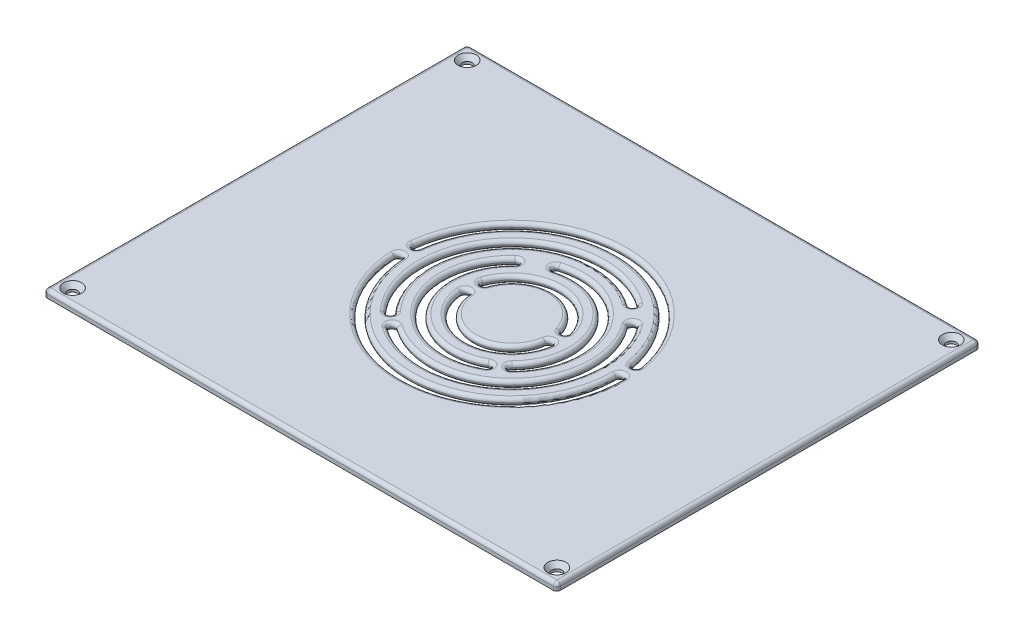
from build123d import *

# Parameters (mm, degrees)
BOSS_EXTRUDE1_DEPTH                           = 2
CSK_FOR_3_FLAT_HEAD_MACHINE_SCREW1_AT_2_COUNT = 2
CSK_FOR_3_FLAT_HEAD_MACHINE_SCREW1_AT_2_PITCH = 134.99999999999997
CSK_FOR_3_FLAT_HEAD_MACHINE_SCREW1_AT_3_COUNT = 2
CSK_FOR_3_FLAT_HEAD_MACHINE_SCREW1_AT_3_PITCH = 174.14074767267996
CSK_FOR_3_FLAT_HEAD_MACHINE_SCREW1_AT_4_COUNT = 2
CSK_FOR_3_FLAT_HEAD_MACHINE_SCREW1_AT_4_PITCH = 109.99999999999999
SKETCH8_R                                     = 0.00040494750000225
SKETCH8_R_2                                   = 0.00013498249999858
SKETCH8_R_3                                   = 0.00013498250000184
CUT_EXTRUDE1_DEPTH                            = 2
FILLET2_R                                     = 1
FILLET3_R                                     = 1
FILLET4_R                                     = 1
FILLET5_R                                     = 1
FILLET6_R                                     = 1
FILLET7_R                                     = 1
FILLET8_R                                     = 1
FILLET9_R                                     = 1
FILLET10_R                                    = 1
FILLET11_R                                    = 1
FILLET12_R                                    = 1
FILLET13_R                                    = 1
FILLET14_R                                    = 1
FILLET15_R                                    = 1
FILLET16_R                                    = 1
FILLET17_R                                    = 1


with BuildPart() as part:
    # Sketch1 → Boss-Extrude1 (new body)
    with BuildSketch(Plane(origin=(0, 0, 0), x_dir=(1, 0, 0), z_dir=(0, 1, 0))):
        Polygon((-71.49999999999997, 59), (71.50000000000001, 59), (71.50000000000004, -59), (-71.49999999999996, -59), align=None)
    extrude(amount=BOSS_EXTRUDE1_DEPTH)

    # Sketch7 → CSK for #3 Flat Head Machine Screw1 (revolve, cut)
    with BuildSketch(Plane(origin=(67.50000000000003, 2, 54.99999999999999), x_dir=(0, 0, 1), z_dir=(1, 0, 0))):
        Polygon((0, 0), (-4.9e-16, 1.9999999999999996), (1.3969999999999994, 1.9999999999999996), (1.3969999999999996, 1.3002614106819081), (2.5273, -1.73e-15), align=None)
    csk_for_3_flat_head_machine_screw1 = revolve(axis=Axis((67.50000000000003, 8.34999999999999, 54.99999999999999), (0, -1, 0)), mode=Mode.SUBTRACT)

    # CSK for #3 Flat Head Machine Screw1 at 2: CSK for #3 Flat Head Machine Screw1 ×2
    with Locations(*[(-i * CSK_FOR_3_FLAT_HEAD_MACHINE_SCREW1_AT_2_PITCH, 0, 0) for i in range(1, CSK_FOR_3_FLAT_HEAD_MACHINE_SCREW1_AT_2_COUNT)]):
        add(csk_for_3_flat_head_machine_screw1, mode=Mode.SUBTRACT)

    # CSK for #3 Flat Head Machine Screw1 at 3: CSK for #3 Flat Head Machine Screw1 ×2
    with Locations(*[Vector(-0.7752349855172892, 0, -0.6316729511622358) * (i * CSK_FOR_3_FLAT_HEAD_MACHINE_SCREW1_AT_3_PITCH) for i in range(1, CSK_FOR_3_FLAT_HEAD_MACHINE_SCREW1_AT_3_COUNT)]):
        add(csk_for_3_flat_head_machine_screw1, mode=Mode.SUBTRACT)

    # CSK for #3 Flat Head Machine Screw1 at 4: CSK for #3 Flat Head Machine Screw1 ×2
    with Locations(*[(0, 0, -i * CSK_FOR_3_FLAT_HEAD_MACHINE_SCREW1_AT_4_PITCH) for i in range(1, CSK_FOR_3_FLAT_HEAD_MACHINE_SCREW1_AT_4_COUNT)]):
        add(csk_for_3_flat_head_machine_screw1, mode=Mode.SUBTRACT)

    # Sketch8 → Cut-Extrude1 (cut)
    # profile 1 of 9: a face of its own
    with BuildSketch(Plane(origin=(0, 2, 0), x_dir=(1, 0, 0), z_dir=(0, 1, 0))):
        Circle(SKETCH8_R)
        Circle(SKETCH8_R_2, mode=Mode.SUBTRACT)
        with Locations((0.00025007018484301, -0.00010171530798169)):
            Circle(SKETCH8_R_3, mode=Mode.SUBTRACT)
        with Locations((-9.735881093734e-05, 0.00025179825884643)):
            Circle(SKETCH8_R_3, mode=Mode.SUBTRACT)
    # profile 2 of 9: a face of its own
    with BuildSketch(Plane(origin=(0, 2, 0), x_dir=(1, 0, 0), z_dir=(0, 1, 0))):
        with BuildLine():
            ThreePointArc((-30.946443151412506, -1.8260323598653043), (0.9134127633680493, -30.986810339668672), (31.000269965, -4.4e-13))
            ThreePointArc((31.000269965, -4.4e-13), (30.00026996500002, 0.9999999999995707), (29.000269964999998, -4.1162e-13))
            ThreePointArc((29.000269964999998, -4.1162e-13), (0.8544834208559154, -28.987678695031157), (-28.949915818821417, -1.7082248464515866))
            ThreePointArc((-28.949915818821417, -1.7082248464515866), (-30.007083241823825, -0.7688649368628956), (-30.946443151412506, -1.8260323598653043))
        make_face()
    # profile 3 of 9: a face of its own
    with BuildSketch(Plane(origin=(0, 2, 0), x_dir=(1, 0, 0), z_dir=(0, 1, 0))):
        with BuildLine():
            ThreePointArc((30.566686260638235, 5.166665166874168), (-0.9217422064956403, 30.986563688276984), (-30.81974870682131, 3.3406328070093023))
            ThreePointArc((-30.81974870682131, 3.3406328070093023), (-29.93333333267017, 2.2386946125226626), (-28.831395138183524, 3.1251099866738055))
            ThreePointArc((-28.831395138183524, 3.1251099866738055), (-0.8622754852357087, 28.987447956493902), (28.59465915925178, 4.83333483312498))
            ThreePointArc((28.59465915925178, 4.83333483312498), (29.747337876819604, 4.013986449306345), (30.566686260638235, 5.166665166874168))
        make_face()
    # profile 4 of 9: a face of its own
    with BuildSketch(Plane(origin=(0, 2, 0), x_dir=(1, 0, 0), z_dir=(0, 1, 0))):
        with BuildLine():
            ThreePointArc((14.890218866781684, 20.08220307690916), (-18.60991899447516, 16.69384357605982), (-18.35268417081552, -16.976232858004106))
            ThreePointArc((-18.35268417081552, -16.976232858004106), (-16.939542749611693, -17.031290315973095), (-16.8844852916427, -15.618148894769266))
            ThreePointArc((-16.8844852916427, -15.618148894769266), (-17.121141551629247, 15.358350511430444), (13.699014220781644, 18.475644179343345))
            ThreePointArc((13.699014220781644, 18.475644179343345), (15.09789599256457, 18.683321305126235), (14.890218866781684, 20.08220307690916))
        make_face()
    # profile 5 of 9: a face of its own
    with BuildSketch(Plane(origin=(0, 2, 0), x_dir=(1, 0, 0), z_dir=(0, 1, 0))):
        with BuildLine():
            ThreePointArc((-14.436978590399093, -20.410466616499455), (17.86500741837908, -17.48871088056924), (20.0985498566952, 14.86814689128468))
            ThreePointArc((20.0985498566952, 14.86814689128468), (18.699897090267772, 15.077360750684315), (18.490683230868143, 13.678707984256892))
            ThreePointArc((18.490683230868143, 13.678707984256892), (16.435822258107635, -16.08962911824803), (-13.282032774965058, -18.777646919346292))
            ThreePointArc((-13.282032774965058, -18.777646919346292), (-14.675915531258662, -19.016583860205856), (-14.436978590399093, -20.410466616499455))
        make_face()
    # profile 6 of 9: a face of its own
    with BuildSketch(Plane(origin=(0, 2, 0), x_dir=(1, 0, 0), z_dir=(0, 1, 0))):
        with BuildLine():
            ThreePointArc((13.407298044144591, -13.463083521183313), (16.370478001502615, 9.644568872956423), (-5.277773611713719, 18.252544054086805))
            ThreePointArc((-5.277773611713719, 18.252544054086805), (-5.960646563849325, 17.014123878523765), (-4.722226388286285, 16.33125092638815))
            ThreePointArc((-4.722226388286285, 16.33125092638815), (14.64729427499154, 8.629365521559576), (11.996023565535404, -12.045936970530784))
            ThreePointArc((11.996023565535404, -12.045936970530784), (11.993087529513732, -13.460147485161643), (13.407298044144591, -13.463083521183313))
        make_face()
    # profile 7 of 9: a face of its own
    with BuildSketch(Plane(origin=(0, 2, 0), x_dir=(1, 0, 0), z_dir=(0, 1, 0))):
        with BuildLine():
            ThreePointArc((-13.033097685767059, 13.825650923415305), (-15.34968359879394, -11.198101274760713), (9.186611442658458, -16.631789709604245))
            ThreePointArc((9.186611442658458, -16.631789709604245), (9.578457362777508, -15.272945798448134), (8.219613451621395, -14.88109987832908))
            ThreePointArc((8.219613451621395, -14.88109987832908), (-13.733950387942805, -10.019370520367382), (-11.661212158900858, 12.370339925320728))
            ThreePointArc((-11.661212158900858, 12.370339925320728), (-11.61949942328667, 13.783938187801112), (-13.033097685767059, 13.825650923415305))
        make_face()
    # profile 8 of 9: a face of its own
    with BuildSketch(Plane(origin=(0, 2, 0), x_dir=(1, 0, 0), z_dir=(0, 1, 0))):
        with BuildLine():
            ThreePointArc((12.507486111078903, 3.545392833530498), (0.2917565528968115, 12.996995701958314), (-12.335793314493415, 4.103074757420425))
            ThreePointArc((-12.335793314493415, 4.103074757420425), (-11.702520422527517, 2.838572703526824), (-10.438018368633914, 3.471845595492722))
            ThreePointArc((-10.438018368633914, 3.471845595492722), (0.2468718614738936, 10.997499424273393), (10.583297437343331, 2.999959108988534))
            ThreePointArc((10.583297437343331, 2.999959108988534), (11.8181086364821, 2.3105816343917303), (12.507486111078903, 3.545392833530498))
        make_face()
    # profile 9 of 9: a face of its own
    with BuildSketch(Plane(origin=(0, 2, 0), x_dir=(1, 0, 0), z_dir=(0, 1, 0))):
        with BuildLine():
            ThreePointArc((-12.933735735852103, -1.3135825356723971), (-0.2809576911659622, -12.99723362637819), (12.864889757990937, -1.8712644595623238))
            ThreePointArc((12.864889757990937, -1.8712644595623238), (12.019243834635018, -0.7377376745627237), (10.885717049635417, -1.5833835979186432))
            ThreePointArc((10.885717049635417, -1.5833835979186432), (-0.23773432858620466, -10.997700745696472), (-10.943971558543012, -1.1114971114144552))
            ThreePointArc((-10.943971558543012, -1.1114971114144552), (-12.039896359326528, -0.21765773488888074), (-12.933735735852103, -1.3135825356723971))
        make_face()
    extrude(amount=-CUT_EXTRUDE1_DEPTH, mode=Mode.SUBTRACT)


with BuildPart() as cut_extrude1_kept_piece:
    # of the separate pieces the step leaves, the one the design keeps (cut_extrude1_pieces_kept)
    add(part.part.solids().sort_by_distance((-71.5, 0, -59))[0])

    # Fillet2
    fillet2_edges = [cut_extrude1_kept_piece.edges().sort_by_distance(p)[0] for p in [
        (-11.619499423286673, 2, -13.783938187801114),
        (-15.34968359879394, 2, 11.198101274760713),
        (9.578457362777508, 2, 15.272945798448132),
        (-13.7339503879428, 2, 10.019370520367383),
    ]]
    fillet(fillet2_edges, radius=FILLET2_R)

    # Fillet3
    fillet3_edges = [cut_extrude1_kept_piece.edges().sort_by_distance(p)[0] for p in [
        (29.7473378768196, 2, -4.013986449306344),
        (-0.9217422064956402, 2, -30.986563688276984),
        (-29.933333332670166, 2, -2.2386946125226617),
        (-0.8622754852357071, 2, -28.98744795649391),
    ]]
    fillet(fillet3_edges, radius=FILLET3_R)

    # Fillet4
    fillet4_edges = [cut_extrude1_kept_piece.edges().sort_by_distance(p)[0] for p in [
        (-0.9217422064956402, 0, -30.986563688276984),
        (29.7473378768196, 0, -4.013986449306344),
        (-0.8622754852357071, 0, -28.98744795649391),
        (-29.933333332670166, 0, -2.2386946125226617),
    ]]
    fillet(fillet4_edges, radius=FILLET4_R - 0.0001)  # a hair under: the kernel refuses the full size

    # Fillet5
    fillet5_edges = [cut_extrude1_kept_piece.edges().sort_by_distance(p)[0] for p in [
        (11.993087529513732, 0, 13.460147485161643),
        (14.647294274991536, 0, -8.629365521559576),
        (-5.960646563849323, 0, -17.014123878523765),
        (16.370478001502615, 0, -9.64456887295642),
    ]]
    fillet(fillet5_edges, radius=FILLET5_R)

    # Fillet6
    fillet6_edges = [cut_extrude1_kept_piece.edges().sort_by_distance(p)[0] for p in [
        (15.09789599256457, 2, -18.683321305126235),
        (-18.609918994475155, 2, -16.69384357605982),
        (-16.93954274961169, 2, 17.03129031597309),
        (-17.121141551629247, 2, -15.358350511430444),
    ]]
    fillet(fillet6_edges, radius=FILLET6_R)

    # Fillet7
    fillet7_edges = [cut_extrude1_kept_piece.edges().sort_by_distance(p)[0] for p in [
        (-17.121141551629247, 0, -15.358350511430444),
        (-16.93954274961169, 0, 17.03129031597309),
        (-18.609918994475155, 0, -16.69384357605982),
        (15.09789599256457, 0, -18.683321305126235),
    ]]
    fillet(fillet7_edges, radius=FILLET7_R - 0.0001)  # a hair under: the kernel refuses the full size

    # Fillet8
    fillet8_edges = [cut_extrude1_kept_piece.edges().sort_by_distance(p)[0] for p in [
        (-12.039896359326528, 0, 0.21765773488888085),
        (-0.2377343285862057, 0, 10.997700745696472),
        (12.019243834635018, 0, 0.7377376745627235),
        (-0.2809576911659626, 0, 12.997233626378192),
    ]]
    fillet(fillet8_edges, radius=FILLET8_R)

    # Fillet9
    fillet9_edges = [cut_extrude1_kept_piece.edges().sort_by_distance(p)[0] for p in [
        (9.578457362777508, 0, 15.272945798448132),
        (-13.7339503879428, 0, 10.019370520367383),
        (-15.34968359879394, 0, 11.198101274760713),
        (-11.619499423286673, 0, -13.783938187801114),
    ]]
    fillet(fillet9_edges, radius=FILLET9_R - 0.0001)  # a hair under: the kernel refuses the full size

    # Fillet10
    fillet10_edges = [cut_extrude1_kept_piece.edges().sort_by_distance(p)[0] for p in [
        (-0.2809576911659626, 2, 12.997233626378192),
        (12.019243834635018, 2, 0.7377376745627235),
        (-0.2377343285862057, 2, 10.997700745696472),
        (-12.039896359326528, 2, 0.21765773488888085),
    ]]
    fillet(fillet10_edges, radius=FILLET10_R - 0.0001)  # a hair under: the kernel refuses the full size

    # Fillet11
    fillet11_edges = [cut_extrude1_kept_piece.edges().sort_by_distance(p)[0] for p in [
        (-30.00708324182382, 0, 0.768864936862895),
        (0.8544834208559159, 0, 28.987678695031157),
        (30.00026996500001, 0, -0.9999999999995712),
        (0.9134127633680436, 0, 30.986810339668672),
    ]]
    fillet(fillet11_edges, radius=FILLET11_R)

    # Fillet12
    fillet12_edges = [cut_extrude1_kept_piece.edges().sort_by_distance(p)[0] for p in [
        (-14.675915531258662, 2, 19.016583860205856),
        (17.865007418379086, 2, 17.488710880569233),
        (18.699897090267775, 2, -15.077360750684319),
        (16.435822258107645, 2, 16.089629118248023),
    ]]
    fillet(fillet12_edges, radius=FILLET12_R)

    # Fillet13
    fillet13_edges = [cut_extrude1_kept_piece.edges().sort_by_distance(p)[0] for p in [
        (11.8181086364821, 2, -2.3105816343917303),
        (0.2917565528968109, 2, -12.996995701958316),
        (-11.702520422527517, 2, -2.8385727035268236),
        (0.24687186147389406, 2, -10.997499424273396),
    ]]
    fillet(fillet13_edges, radius=FILLET13_R)

    # Fillet14
    fillet14_edges = [cut_extrude1_kept_piece.edges().sort_by_distance(p)[0] for p in [
        (11.8181086364821, 0, -2.3105816343917303),
        (0.24687186147389406, 0, -10.997499424273396),
        (-11.702520422527517, 0, -2.8385727035268236),
        (0.2917565528968109, 0, -12.996995701958316),
    ]]
    fillet(fillet14_edges, radius=FILLET14_R - 0.0001)  # a hair under: the kernel refuses the full size

    # Fillet15
    fillet15_edges = [cut_extrude1_kept_piece.edges().sort_by_distance(p)[0] for p in [
        (16.370478001502615, 2, -9.64456887295642),
        (-5.960646563849323, 2, -17.014123878523765),
        (14.647294274991536, 2, -8.629365521559576),
        (11.993087529513732, 2, 13.460147485161643),
        (0.9134127633680436, 2, 30.986810339668672),
        (30.00026996500001, 2, -0.9999999999995712),
        (0.8544834208559159, 2, 28.987678695031157),
        (-30.00708324182382, 2, 0.768864936862895),
    ]]
    fillet(fillet15_edges, radius=FILLET15_R - 0.0001)  # a hair under: the kernel refuses the full size

    # Fillet16
    fillet16_edges = [cut_extrude1_kept_piece.edges().sort_by_distance(p)[0] for p in [
        (-14.675915531258662, 0, 19.016583860205856),
        (18.699897090267775, 0, -15.077360750684319),
        (16.435822258107645, 0, 16.089629118248023),
        (17.86500741837908, 0, 17.488710880569233),
    ]]
    fillet(fillet16_edges, radius=FILLET16_R - 0.0001)  # a hair under: the kernel refuses the full size

    # Fillet17
    fillet17_edges = [cut_extrude1_kept_piece.edges().sort_by_distance(p)[0] for p in [
        (-71.49999999999997, 2, 0),
        (4.263e-14, 2, 59),
        (71.50000000000003, 2, 0),
        (71.50000000000004, 1, 59),
        (-71.49999999999996, 1, 59),
        (-71.49999999999997, 1, -59),
        (71.50000000000001, 1, -59),
        (2.842e-14, 2, -59),
    ]]
    fillet(fillet17_edges, radius=FILLET17_R)


solid = cut_extrude1_kept_piece.part
